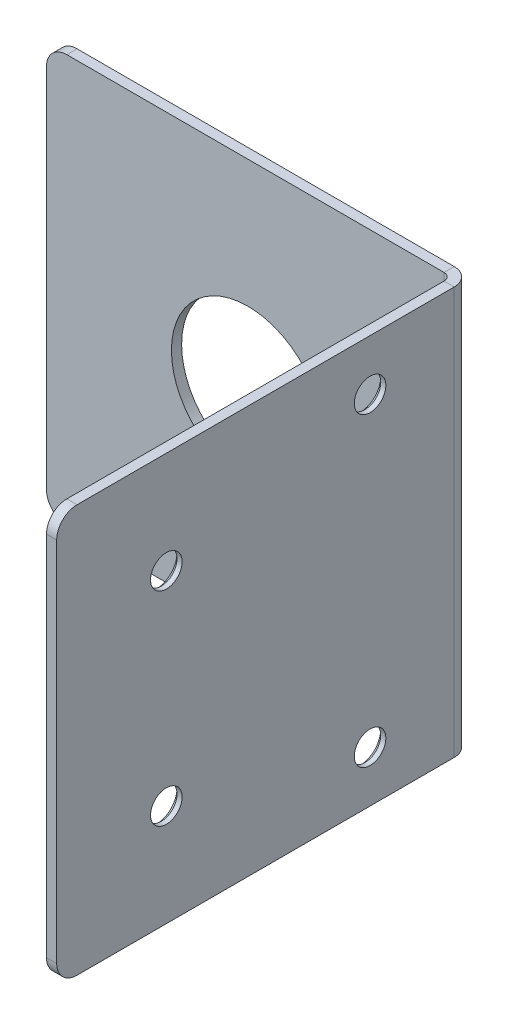
from build123d import *

# Parameters (mm, degrees)
SKETCH1_W               = 80
SKETCH1_H               = 40
BASE_FLANGE1_DEPTH      = 1
SKETCHED_START          = -20
SKETCHED_BEND1_DEPTH    = 40
SKETCHED_BEND1_2_DEPTH  = 40
FILLET1_R               = 2
SKETCH9_R               = 1.55
CUT_EXTRUDE1_DEPTH      = 60.687271317
CUT_EXTRUDE3_DEPTH      = 61.512940202
CUT_EXTRUDE3_DEPTH_BACK = 61.512940202
SKETCH10_R              = 7.5
CHAMFER1_SIZE           = 0.5


# Read off the part's stored shape, not the designer's step: Sketched Bend1
# Sheet-metal steps are written as plain solids
with BuildPart() as part:
    # Sketch1 → Base-Flange1 (new body)
    with BuildSketch(Plane.XY):
        Rectangle(SKETCH1_W, SKETCH1_H)
    extrude(amount=-BASE_FLANGE1_DEPTH)

    # Sketched Bend1 outline → Sketched Bend1 (cut)
    with BuildSketch(Plane(origin=(0, 0, 0), x_dir=(1, 0, 0), z_dir=(0, 1, 0)).offset(SKETCHED_START)):
        with BuildLine():
            ThreePointArc((-0.971223369, 1), (-0.039397205, 0.728828115), (0.601417721, 0))
            Line((0.601417721, 0), (40, 0))
            Line((40, 0), (40, 1))
            Line((40, 1), (-0.971223369, 1))
        make_face()
    extrude(amount=SKETCHED_BEND1_DEPTH, mode=Mode.SUBTRACT)

    # Sketched Bend1 2 outline → Sketched Bend1 2 (add)
    with BuildSketch(Plane(origin=(0, 0, 0), x_dir=(1, 0, 0), z_dir=(0, 1, 0)).offset(SKETCHED_START)):
        with BuildLine():
            Line((-0.234623369, -0.7366), (-0.234623369, -39.765376631))
            Line((-0.234623369, -39.765376631), (0.765376631, -39.765376631))
            Line((0.765376631, -39.765376631), (0.765376631, -0.7366))
            ThreePointArc((0.765376631, -0.7366), (0.723891388, -0.359286442), (0.601417721, 0))
            Line((0.601417721, 0), (-0.971223369, 0))
            ThreePointArc((-0.971223369, 0), (-0.450368514, -0.215745145), (-0.234623369, -0.7366))
        make_face()
    extrude(amount=SKETCHED_BEND1_2_DEPTH)

    # Fillet1
    fillet1_edges = [part.edges().sort_by_distance(p)[0] for p in [
        (-40, -20, -0.5),
        (-40, 20, -0.5),
        (0.265376631, -20, 39.765376631),
        (0.265376631, 20, 39.765376631),
    ]]
    fillet(fillet1_edges, radius=FILLET1_R)

    # Sketch9 → Cut-Extrude1 (cut, through all)
    with BuildSketch(Plane.ZY.offset(0.234623369)):
        with Locations((9, 15)):
            Circle(SKETCH9_R)
        with Locations((29, 10)):
            Circle(SKETCH9_R)
        with Locations(Location((29, -10, 0), (0, 0, 180))):
            Circle(SKETCH9_R)
        with Locations(Location((9, -15, 0), (0, 0, 180))):
            Circle(SKETCH9_R)
    extrude(amount=-CUT_EXTRUDE1_DEPTH, mode=Mode.SUBTRACT)

    # Sketch10 → Cut-Extrude3 (cut, two sides: drawn at the far end of the back side and taken through both)
    with BuildSketch(Plane(origin=(0, 0, -1), x_dir=(-1, 0, 0), z_dir=(0, 0, -1)).offset(-CUT_EXTRUDE3_DEPTH_BACK)):
        with Locations((20.234623369, 0)):
            Circle(SKETCH10_R)
    extrude(amount=CUT_EXTRUDE3_DEPTH + CUT_EXTRUDE3_DEPTH_BACK, mode=Mode.SUBTRACT)

    # Chamfer1
    chamfer1_edges = [part.edges().sort_by_distance(p)[0] for p in [
        (-0.234623369, 15, 7.45),
        (-0.234623369, 10, 27.45),
        (-0.234623369, -10, 30.55),
        (-0.234623369, -15, 10.55),
    ]]
    chamfer(chamfer1_edges, length=CHAMFER1_SIZE)


solid = part.part
